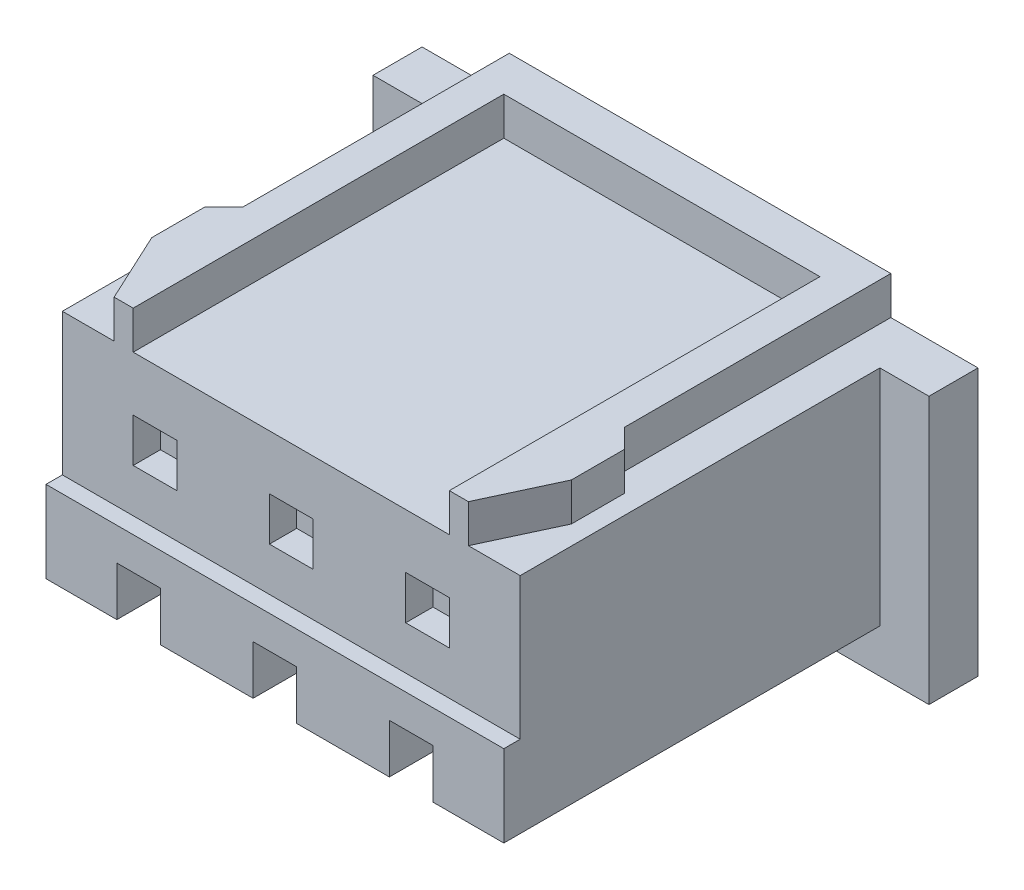
from build123d import *

# Parameters (mm, degrees)
ESQUISSE1_W             = 10.2
ESQUISSE1_H             = 5.6
BOSS_EXTRU_1_DEPTH      = 7.8
ESQUISSE2_W             = 10.2
ESQUISSE2_H             = 3.3
ENL_V_MAT_EXTRU_1_DEPTH = 0.3
ENL_V_MAT_EXTRU_2_DEPTH = 6.9
ESQUISSE5_W             = 5.8
ESQUISSE5_H             = 6.8
ENL_V_MAT_EXTRU_3_DEPTH = 0.7
ESQUISSE6_W             = 0.8
ESQUISSE6_H             = 0.9
ENL_V_MAT_EXTRU_4_DEPTH = 0.8
ESQUISSE7_W             = 0.8
ESQUISSE7_H             = 0.8
ENL_V_MAT_EXTRU_5_DEPTH = 0.5
ENL_V_MAT_EXTRU_6_DEPTH = 7
ENL_V_MAT_EXTRU_7_DEPTH = 0.8
ESQUISSE10_R            = 0.6
ENL_V_MAT_EXTRU_8_DEPTH = 0.5
ESQUISSE11_W            = 0.8
ESQUISSE11_H            = 0.3
ENL_V_MAT_EXTRU_9_DEPTH = 2.2


with BuildPart() as part:
    # Esquisse1 → Boss.-Extru.1 (new body)
    with BuildSketch(Plane.XY):
        Rectangle(ESQUISSE1_W, ESQUISSE1_H)
    extrude(amount=-BOSS_EXTRU_1_DEPTH)

    # Esquisse2 → Enlèv. mat.-Extru.1 (cut)
    with BuildSketch(Plane.XY):
        with Locations((0, 1.15)):
            Rectangle(ESQUISSE2_W, ESQUISSE2_H)
    extrude(amount=-ENL_V_MAT_EXTRU_1_DEPTH, mode=Mode.SUBTRACT)

    # Esquisse4 → Enlèv. mat.-Extru.2 (cut)
    with BuildSketch(Plane.XY):
        Polygon((5.1, 2.8), (4.2, 2.8), (4.2, -2), (-4.2, -2), (-4.2, 2.8), (-5.1, 2.8), (-5.1, -2.8), (5.1, -2.8), align=None)
    extrude(amount=-ENL_V_MAT_EXTRU_2_DEPTH, mode=Mode.SUBTRACT)

    # Esquisse5 → Enlèv. mat.-Extru.3 (cut)
    with BuildSketch(Plane(origin=(0, 2.8, 0), x_dir=(1, 0, 0), z_dir=(0, 1, 0))):
        Polygon((-3.5, 2.91), (-3.5, 7.8), (-5.1, 7.8), (-5.1, 6.9), (-4.2, 6.9), (-4.2, 0.3), (-3.25, 0.3), (-3.85, 1.59), (-3.85, 2.56), align=None)
        with Locations((0, 3.7)):
            Rectangle(ESQUISSE5_W, ESQUISSE5_H)
        Polygon((5.1, 7.8), (3.5, 7.8), (3.5, 2.91), (3.85, 2.56), (3.85, 1.59), (3.25, 0.3), (4.2, 0.3), (4.2, 6.9), (5.1, 6.9), align=None)
    extrude(amount=-ENL_V_MAT_EXTRU_3_DEPTH, mode=Mode.SUBTRACT)

    # Esquisse6 → Enlèv. mat.-Extru.4 (cut)
    with BuildSketch(Plane.XY):
        with Locations((-2.5, -1.55)):
            Rectangle(ESQUISSE6_W, ESQUISSE6_H)
        with Locations((0, -1.55)):
            Rectangle(ESQUISSE6_W, ESQUISSE6_H)
        with Locations((2.5, -1.55)):
            Rectangle(ESQUISSE6_W, ESQUISSE6_H)
    extrude(amount=-ENL_V_MAT_EXTRU_4_DEPTH, mode=Mode.SUBTRACT)

    # Esquisse7 → Enlèv. mat.-Extru.5 (cut)
    with BuildSketch(Plane.XY.offset(-0.3)):
        with Locations((-2.5, 0.7)):
            Rectangle(ESQUISSE7_W, ESQUISSE7_H)
        with Locations((0, 0.7)):
            Rectangle(ESQUISSE7_W, ESQUISSE7_H)
        with Locations((2.5, 0.7)):
            Rectangle(ESQUISSE7_W, ESQUISSE7_H)
    extrude(amount=-ENL_V_MAT_EXTRU_5_DEPTH, mode=Mode.SUBTRACT)

    # Esquisse8 → Enlèv. mat.-Extru.6 (cut)
    # profile 1 of 3: a face of its own
    with BuildSketch(Plane(origin=(0, 0, -7.8), x_dir=(-1, 0, 0), z_dir=(0, 0, -1))):
        Polygon((0.8, 1.5), (-0.8, 1.5), (-0.8, -1.5), (-0.4, -1.5), (-0.4, -1.7), (0.4, -1.7), (0.4, -1.5), (0.8, -1.5), align=None)
        with BuildLine():
            Line((-0.7, -1.45), (-0.7, 0.95))
            ThreePointArc((-0.7, 0.95), (-0.35, 1.3), (0, 0.95))
            ThreePointArc((0, 0.95), (0.35, 1.3), (0.7, 0.95))
            Line((0.7, 0.95), (0.7, -1.45))
            Line((0.7, -1.45), (-0.7, -1.45))
        make_face(mode=Mode.SUBTRACT)
    # profile 2 of 3: a face of its own
    with BuildSketch(Plane(origin=(0, 0, -7.8), x_dir=(-1, 0, 0), z_dir=(0, 0, -1))):
        Polygon((3.3, 1.5), (1.7, 1.5), (1.7, -1.5), (2.1, -1.5), (2.1, -1.7), (2.9, -1.7), (2.9, -1.5), (3.3, -1.5), align=None)
        with BuildLine():
            Line((1.8, -1.45), (1.8, 0.95))
            ThreePointArc((1.8, 0.95), (2.15, 1.3), (2.5, 0.95))
            ThreePointArc((2.5, 0.95), (2.85, 1.3), (3.2, 0.95))
            Line((3.2, 0.95), (3.2, -1.45))
            Line((3.2, -1.45), (1.8, -1.45))
        make_face(mode=Mode.SUBTRACT)
    # profile 3 of 3: a face of its own
    with BuildSketch(Plane(origin=(0, 0, -7.8), x_dir=(-1, 0, 0), z_dir=(0, 0, -1))):
        Polygon((-1.7, 1.5), (-3.3, 1.5), (-3.3, -1.5), (-2.9, -1.5), (-2.9, -1.7), (-2.1, -1.7), (-2.1, -1.5), (-1.7, -1.5), align=None)
        with BuildLine():
            Line((-3.2, -1.45), (-3.2, 0.95))
            ThreePointArc((-3.2, 0.95), (-2.85, 1.3), (-2.5, 0.95))
            ThreePointArc((-2.5, 0.95), (-2.15, 1.3), (-1.8, 0.95))
            Line((-1.8, 0.95), (-1.8, -1.45))
            Line((-1.8, -1.45), (-3.2, -1.45))
        make_face(mode=Mode.SUBTRACT)
    extrude(amount=-ENL_V_MAT_EXTRU_6_DEPTH, mode=Mode.SUBTRACT)

    # Esquisse9 → Enlèv. mat.-Extru.7 (cut)
    with BuildSketch(Plane(origin=(0, 0, -7.8), x_dir=(-1, 0, 0), z_dir=(0, 0, -1))):
        with BuildLine():
            Line((-0.7, 0.95), (-0.7, -1.45))
            Line((-0.7, -1.45), (0.7, -1.45))
            Line((0.7, -1.45), (0.7, 0.95))
            ThreePointArc((0.7, 0.95), (0.35, 1.3), (0, 0.95))
            ThreePointArc((0, 0.95), (-0.35, 1.3), (-0.7, 0.95))
        make_face()
        with BuildLine():
            Line((-3.2, 0.95), (-3.2, -1.45))
            Line((-3.2, -1.45), (-1.8, -1.45))
            Line((-1.8, -1.45), (-1.8, 0.95))
            ThreePointArc((-1.8, 0.95), (-2.15, 1.3), (-2.5, 0.95))
            ThreePointArc((-2.5, 0.95), (-2.85, 1.3), (-3.2, 0.95))
        make_face()
        with BuildLine():
            Line((1.8, 0.95), (1.8, -1.45))
            Line((1.8, -1.45), (3.2, -1.45))
            Line((3.2, -1.45), (3.2, 0.95))
            ThreePointArc((3.2, 0.95), (2.85, 1.3), (2.5, 0.95))
            ThreePointArc((2.5, 0.95), (2.15, 1.3), (1.8, 0.95))
        make_face()
    extrude(amount=-ENL_V_MAT_EXTRU_7_DEPTH, mode=Mode.SUBTRACT)

    # Esquisse10 → Enlèv. mat.-Extru.8 (cut)
    with BuildSketch(Plane(origin=(0, 0, -7), x_dir=(-1, 0, 0), z_dir=(0, 0, -1))):
        Circle(ESQUISSE10_R)
        with Locations((-2.5, 0)):
            Circle(ESQUISSE10_R)
        with Locations((2.5, 0)):
            Circle(ESQUISSE10_R)
    extrude(amount=-ENL_V_MAT_EXTRU_8_DEPTH, mode=Mode.SUBTRACT)

    # Esquisse11 → Enlèv. mat.-Extru.9 (cut)
    with BuildSketch(Plane.XY.offset(-0.8)):
        with Locations((-2.5, -1.85)):
            Rectangle(ESQUISSE11_W, ESQUISSE11_H)
        with Locations((0, -1.85)):
            Rectangle(ESQUISSE11_W, ESQUISSE11_H)
        with Locations((2.5, -1.85)):
            Rectangle(ESQUISSE11_W, ESQUISSE11_H)
    extrude(amount=-ENL_V_MAT_EXTRU_9_DEPTH, mode=Mode.SUBTRACT)


solid = part.part
